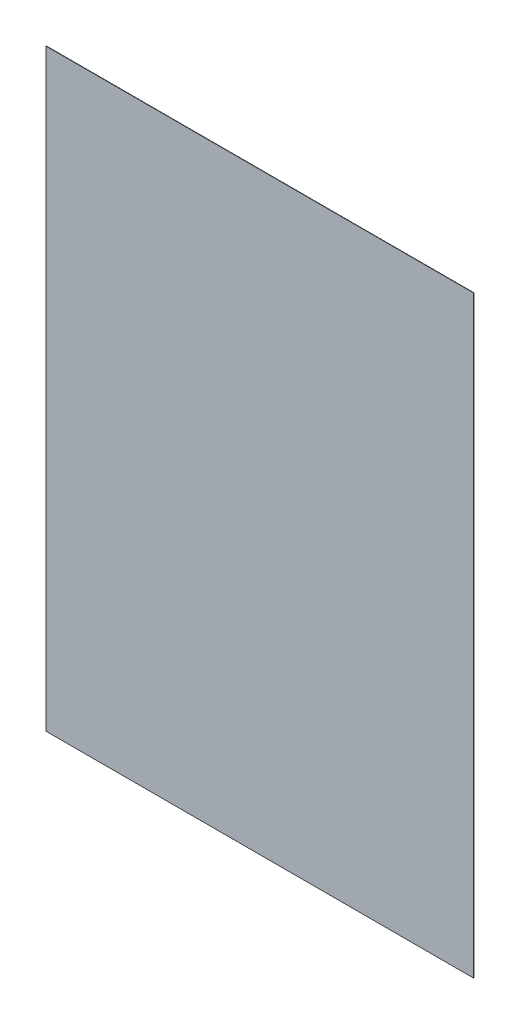
from build123d import *

# Parameters (mm, degrees)
SKETCH1_W           = 1170
SKETCH1_H           = 1625
BOSS_EXTRUDE1_DEPTH = 1


with BuildPart() as part:
    # Sketch1 → Boss-Extrude1 (new body)
    with BuildSketch(Plane.XY):
        with Locations((585, 812.5)):
            Rectangle(SKETCH1_W, SKETCH1_H)
    extrude(amount=BOSS_EXTRUDE1_DEPTH)


solid = part.part
